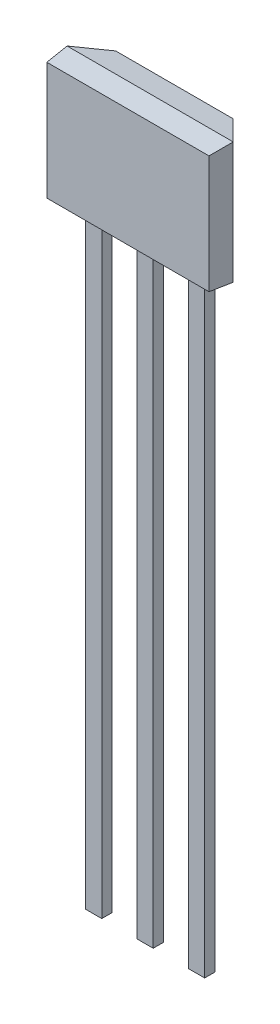
from build123d import *

# Parameters (mm, degrees)
SKETCH_1_W             = 4.1
SKETCH_1_H             = 3
EXTRUDE_1_DEPTH        = 1.15
CUT_EXTRUDE_1_DEPTH    = 4.8111678
CUT_EXTRUDE_2_DEPTH    = 5.926966612
EXTRUDE_2_DEPTH        = 0.125
EXTRUDE_2_DEPTH_BACK   = 0.125
SKETCH_5_W             = 0.4
SKETCH_5_H             = 15.2
EXTRUDE_2_2_DEPTH      = 0.125
EXTRUDE_2_2_DEPTH_BACK = 0.125
EXTRUDE_2_3_DEPTH      = 0.125
EXTRUDE_2_3_DEPTH_BACK = 0.125
SKETCH_7_R             = 0.15
EXTRUDE_3_DEPTH        = 0.1


with BuildPart() as part:
    # 草圖1 → 填料-伸長1 (new body)
    with BuildSketch(Plane.XY):
        Rectangle(SKETCH_1_W, SKETCH_1_H)
    extrude(amount=EXTRUDE_1_DEPTH)

    # 草圖2 → 除料-伸長1 (cut, through all)
    with BuildSketch(Plane.XZ.offset(1.5)):
        Polygon((-2.001881235, 1.15), (-2.05, 1.15), (-2.05, 0.6), align=None)
        Polygon((2.001881235, 1.15), (2.05, 0.6), (2.05, 1.15), align=None)
        Polygon((2.05, 0.6), (1.45, 0), (2.05, 0), align=None)
        Polygon((-1.45, 0), (-2.05, 0.6), (-2.05, 0), align=None)
    extrude(amount=-CUT_EXTRUDE_1_DEPTH, mode=Mode.SUBTRACT)

    # 草圖3 → 除料-伸長2 (cut, through all)
    with BuildSketch(Plane(origin=(2.5, 0, 0), x_dir=(0, 0, -1), z_dir=(1, 0, 0))):
        Polygon((-1.15, -1.451881235), (-1.15, -1.5), (-0.6, -1.5), align=None)
        Polygon((0, -1.394203812), (-0.6, -1.5), (0, -1.5), align=None)
        Polygon((0, 1.394203812), (0, 1.5), (-0.6, 1.5), align=None)
        Polygon((-1.15, 1.451881235), (-0.6, 1.5), (-1.15, 1.5), align=None)
    extrude(amount=-CUT_EXTRUDE_2_DEPTH, mode=Mode.SUBTRACT)


with BuildPart() as body_2:
    # 草圖5 → 填料-伸長2 (new, two sides: drawn at the far end of the back side and taken through both)
    with BuildSketch(Plane.XY.offset(0.6).offset(-EXTRUDE_2_DEPTH_BACK)):
        with Locations((-1.27, -9)):
            Rectangle(SKETCH_5_W, SKETCH_5_H)
    extrude(amount=EXTRUDE_2_DEPTH + EXTRUDE_2_DEPTH_BACK)


with BuildPart() as body_3:
    # 草圖5 → Extrude 2 2 (new, two sides: drawn at the far end of the back side and taken through both)
    with BuildSketch(Plane.XY.offset(0.6).offset(-EXTRUDE_2_2_DEPTH_BACK)):
        with Locations((0, -9)):
            Rectangle(SKETCH_5_W, SKETCH_5_H)
    extrude(amount=EXTRUDE_2_2_DEPTH + EXTRUDE_2_2_DEPTH_BACK)


with BuildPart() as body_4:
    # 草圖5 → Extrude 2 3 (new, two sides: drawn at the far end of the back side and taken through both)
    with BuildSketch(Plane.XY.offset(0.6).offset(-EXTRUDE_2_3_DEPTH_BACK)):
        with Locations((1.27, -9)):
            Rectangle(SKETCH_5_W, SKETCH_5_H)
    extrude(amount=EXTRUDE_2_3_DEPTH + EXTRUDE_2_3_DEPTH_BACK)


with BuildPart() as body_5:
    # 草圖7 → 填料-伸長3 (new body)
    with BuildSketch(Plane.XY.offset(0.41)):
        with Locations((0, 0.79)):
            Circle(SKETCH_7_R)
    extrude(amount=EXTRUDE_3_DEPTH)


solid = Compound([part.part, body_2.part, body_3.part, body_4.part, body_5.part])
